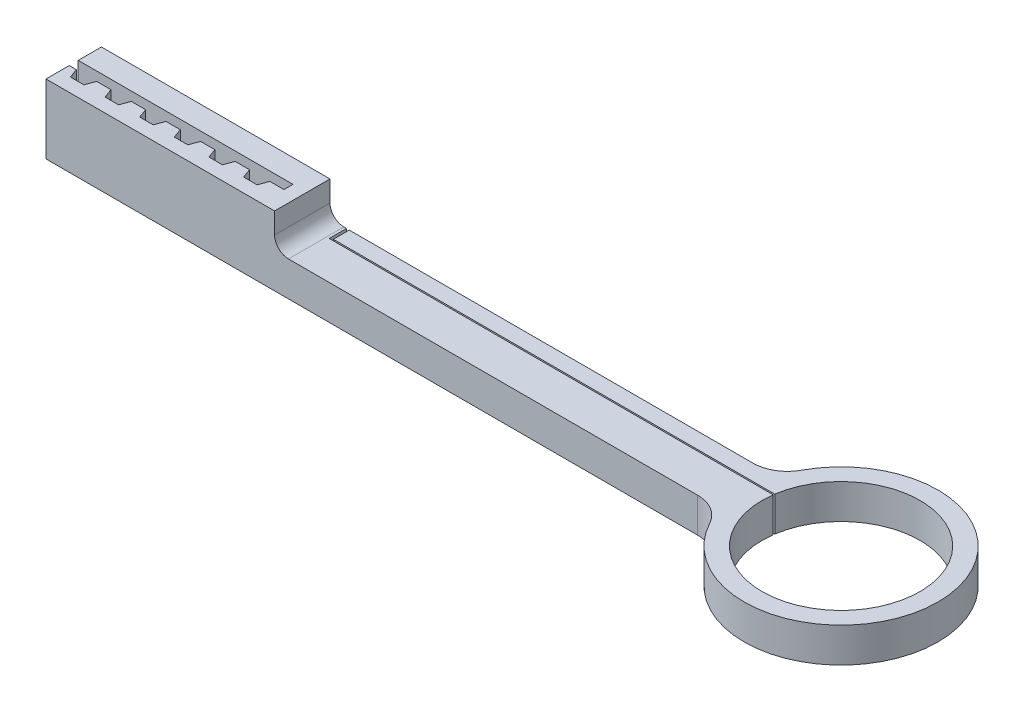
from build123d import *

# Parameters (mm, degrees)
SKETCH_1_R              = 14
SKETCH_1_R_2            = 11.4
RING_DEPTH              = 5
STICK_DEPTH             = 5
SKETCH_3_W              = 33
SKETCH_3_H              = 8
KEY_DEPTH               = 10
FILLET_1_R              = 5
FILLET_5_R              = 2
KEY_HOLE_DEPTH          = 112.914636511
KEY_HOLE_DEPTH_BACK     = 112.914636511
CORRECTION_HOLE_1_DEPTH = 113.109927595
SKETCH_6_W              = 0.5
SKETCH_6_H              = 1.3
CORRECTION_HOLE_DEPTH   = 113.109927595


with BuildPart() as part:
    # Эскиз1 → ring (new body)
    with BuildSketch(Plane(origin=(0, 0, 0), x_dir=(1, 0, 0), z_dir=(0, 1, 0))):
        Circle(SKETCH_1_R)
        Circle(SKETCH_1_R_2, mode=Mode.SUBTRACT)
    extrude(amount=RING_DEPTH)

    # Эскиз2 → stick (add)
    with BuildSketch(Plane(origin=(0, 0, 0), x_dir=(1, 0, 0), z_dir=(0, 1, 0))):
        with BuildLine():
            Line((-10.781929326, 4), (-110.781929326, 4))
            Line((-110.781929326, 4), (-110.781929326, -4))
            Line((-110.781929326, -4), (-10.781929326, -4))
            ThreePointArc((-10.781929326, -4), (-11.5, 0), (-10.781929326, 4))
        make_face()
    extrude(amount=STICK_DEPTH)

    # Эскиз3 → key (add)
    with BuildSketch(Plane(origin=(0, 0, 0), x_dir=(1, 0, 0), z_dir=(0, 1, 0))):
        with Locations((-94.281929326, 0)):
            Rectangle(SKETCH_3_W, SKETCH_3_H)
    extrude(amount=KEY_DEPTH)

    # Скругление1
    fillet_1_edges = [part.edges().sort_by_distance(p)[0] for p in [
        (-13.416407865, 2.5, 4),
        (-13.416407865, 2.5, -4),
    ]]
    fillet(fillet_1_edges, radius=FILLET_1_R)

    # Скругление5
    fillet_5_edges = [part.edges().sort_by_distance(p)[0] for p in [
        (-77.781929326, 5, 0),
    ]]
    fillet(fillet_5_edges, radius=FILLET_5_R)

    # Эскиз4 → key hole (cut, two sides: drawn at the far end of the back side and taken through both)
    with BuildSketch(Plane(origin=(0, 2.5, 0), x_dir=(1, 0, 0), z_dir=(0, 1, 0)).offset(-KEY_HOLE_DEPTH_BACK)):
        Polygon((-110.781929326, 0.65), (-80.281929326, 0.65), (-80.281929326, -0.65), (-80.781929326, -0.65), (-81.81556951, -0.65), (-82.306929326, -2), (-84.256929326, -2), (-84.748289143, -0.65), (-85.781929326, -0.65), (-86.81556951, -0.65), (-87.306929326, -2), (-89.256929326, -2), (-89.748289143, -0.65), (-90.781929326, -0.65), (-91.81556951, -0.65), (-92.306929326, -2), (-94.256929326, -2), (-94.748289143, -0.65), (-95.781929326, -0.65), (-96.81556951, -0.65), (-97.306929326, -2), (-99.256929326, -2), (-99.748289143, -0.65), (-100.781929326, -0.65), (-101.81556951, -0.65), (-102.306929326, -2), (-104.256929326, -2), (-104.748289143, -0.65), (-105.781929326, -0.65), (-106.81556951, -0.65), (-107.306929326, -2), (-109.256929326, -2), (-109.748289143, -0.65), (-110.781929326, -0.65), align=None)
    extrude(amount=KEY_HOLE_DEPTH + KEY_HOLE_DEPTH_BACK, mode=Mode.SUBTRACT)

    # Эскиз5 → correction hole 1 (cut, through all)
    with BuildSketch(Plane.XZ):
        Polygon((-75.4, -4), (-75.4, -1.5), (0, -1.5), (0, -1.7), (-75, -1.7), (-75, -4), align=None)
    extrude(amount=-CORRECTION_HOLE_1_DEPTH, mode=Mode.SUBTRACT)

    # Эскиз6 → correction hole (cut, through all)
    with BuildSketch(Plane(origin=(0, 10, 0), x_dir=(1, 0, 0), z_dir=(0, 1, 0))):
        with Locations((-80.031929326, 0)):
            Rectangle(SKETCH_6_W, SKETCH_6_H)
    extrude(amount=-CORRECTION_HOLE_DEPTH, mode=Mode.SUBTRACT)


solid = part.part
